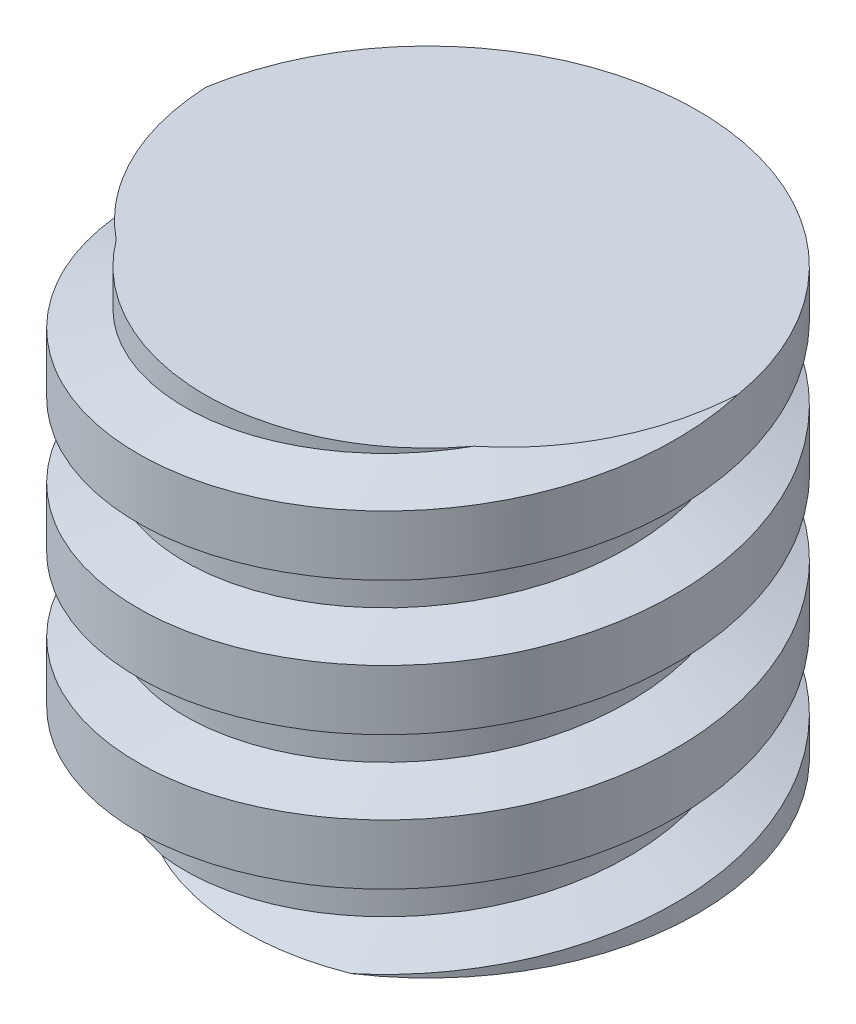
from build123d import *

# Parameters (mm, degrees)
SKETCH_3_W    = 9.5
SKETCH_3_H    = 15
SWEEP_1_PITCH = 4.712


with BuildPart() as part:
    # Эскиз3 → Повернуть1 (revolve)
    with BuildSketch(Plane.XY, mode=Mode.PRIVATE) as revolve_1_sk:
        with Locations((4.75, 7.5)):
            Rectangle(SKETCH_3_W, SKETCH_3_H)
    revolve(revolve_1_sk.sketch.rotate(Axis((0, 0, 0), (0, 1, 0)), 90), axis=Axis((0, 0, 0), (0, 1, 0)))

    # Вырез-По траектории1: arcs per turn and ends read off the stored shape
    # Вырез-По траектории1: the profile of Эскиз7 screwed along a right-hand helix through 8.75 turns, 12 arcs to a turn; built about Z, then put on its axis
    sweep_1_z = Axis((0, 0, 0), (0, 0, 1))
    sweep_1_corners = [(7.85, 0, -4.012550887), (7.85, 0, -5.411449113), (11.15, 0, -6.612550887), (11.15, 0, -2.811449113)]
    with BuildLine(mode=Mode.PRIVATE) as sweep_1_profile:
        Line(sweep_1_corners[0], sweep_1_corners[1])
        Line(sweep_1_corners[1], sweep_1_corners[2])
        Line(sweep_1_corners[2], sweep_1_corners[3])
        Line(sweep_1_corners[3], sweep_1_corners[0])
    sweep_1_cap = Face(sweep_1_profile.wire())
    sweep_1_turn_angles = [0, 15, 30, 45, 60, 75, 90, 105, 120, 135, 150, 165, 180, 195, 210, 225, 240, 255, 270, 285, 300, 315, 330, 345, 360]
    sweep_1_turn_weights = [1, 0.9659258262890683, 1, 0.9659258262890683, 1, 0.9659258262890683, 1, 0.9659258262890683, 1, 0.9659258262890683, 1, 0.9659258262890683, 1, 0.9659258262890683, 1, 0.9659258262890683, 1, 0.9659258262890683, 1, 0.9659258262890683, 1, 0.9659258262890683, 1, 0.9659258262890683, 1]
    sweep_1_turn_rails = [Edge.make_bspline([Vector(p[0], p[1], 0).rotate(sweep_1_z, sweep_1_turn_angles[k]) / sweep_1_turn_weights[k] + Vector(0, 0, p[2] + SWEEP_1_PITCH * sweep_1_turn_angles[k] / 360) for k in range(25)], [0, 0, 0, 1, 1, 2, 2, 3, 3, 4, 4, 5, 5, 6, 6, 7, 7, 8, 8, 9, 9, 10, 10, 11, 11, 12, 12, 12], 2, sweep_1_turn_weights) for p in sweep_1_corners]
    sweep_1_turn_sides = [Face.make_surface_from_curves(sweep_1_turn_rails[p[0]], sweep_1_turn_rails[p[1]]) for p in [(0, 1), (1, 2), (2, 3), (3, 0)]]
    sweep_1_last_angles = [2880, 2895, 2910, 2925, 2940, 2955, 2970, 2985, 3000, 3015, 3030, 3045, 3060, 3075, 3090, 3105, 3120, 3135, 3150]
    sweep_1_last_weights = [1, 0.9659258262890683, 1, 0.9659258262890683, 1, 0.9659258262890683, 1, 0.9659258262890683, 1, 0.9659258262890683, 1, 0.9659258262890683, 1, 0.9659258262890683, 1, 0.9659258262890683, 1, 0.9659258262890683, 1]
    sweep_1_last_rails = [Edge.make_bspline([Vector(p[0], p[1], 0).rotate(sweep_1_z, sweep_1_last_angles[k]) / sweep_1_last_weights[k] + Vector(0, 0, p[2] + SWEEP_1_PITCH * sweep_1_last_angles[k] / 360) for k in range(19)], [0, 0, 0, 1, 1, 2, 2, 3, 3, 4, 4, 5, 5, 6, 6, 7, 7, 8, 8, 9, 9, 9], 2, sweep_1_last_weights) for p in sweep_1_corners]
    sweep_1_last_sides = [Face.make_surface_from_curves(sweep_1_last_rails[p[0]], sweep_1_last_rails[p[1]]) for p in [(0, 1), (1, 2), (2, 3), (3, 0)]]
    sweep_1 = Plane(origin=(0, 15, 0), x_dir=(0, 0, 1), z_dir=(0, -1, 0)) * Solid(Shell([*[p.moved(Location((0, 0, SWEEP_1_PITCH * i))) for i in range(8) for p in sweep_1_turn_sides], *sweep_1_last_sides, sweep_1_cap, sweep_1_cap.rotate(sweep_1_z, 3150).moved(Location((0, 0, SWEEP_1_PITCH * 3150 / 360)))]))
    add(sweep_1, mode=Mode.SUBTRACT)


solid = part.part
